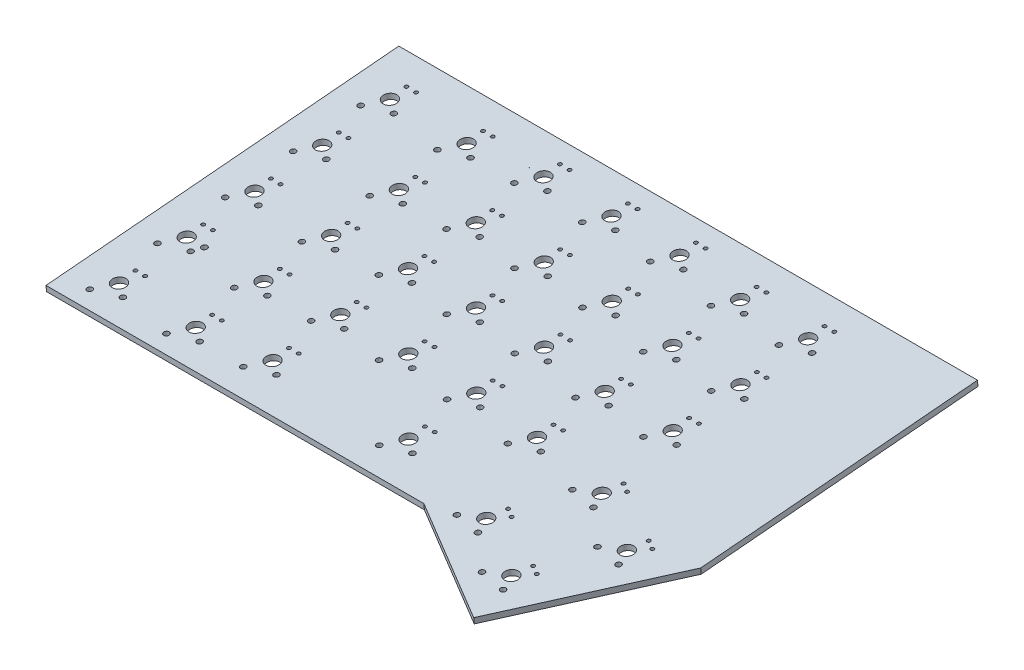
from build123d import *

# Parameters (mm, degrees)
STOCK_KEYBOARD_V0_5_1_START       = 8.153585203
STOCK_KEYBOARD_V0_5_1_OUTLINE_W   = 0.86
STOCK_KEYBOARD_V0_5_1_OUTLINE_H   = 0.199238939
STOCK_KEYBOARD_V0_5_1_OUTLINE_R   = 0.8
STOCK_KEYBOARD_V0_5_1_OUTLINE_R_2 = 1.917674794
STOCK_KEYBOARD_V0_5_1_OUTLINE_H_2 = 0.19923894
STOCK_KEYBOARD_V0_5_1_OUTLINE_R_3 = 0.800000002
STOCK_KEYBOARD_V0_5_1_DEPTH       = 1.6
BOSS_EXTRUDE1_DEPTH               = 2
SKETCH2_W                         = 12.211122084
SKETCH2_H                         = 11.225799909
BOSS_EXTRUDE2_DEPTH               = 1.6
SKETCH8_R                         = 0.800000002
SKETCH8_R_2                       = 1.917674794
SKETCH8_R_3                       = 0.8
SKETCH8_W                         = 0.86
SKETCH8_H                         = 0.199238939
SKETCH8_H_2                       = 0.19923894
CUT_EXTRUDE2_DEPTH                = 10
SKETCH9_W                         = 18.636404388
SKETCH9_H                         = 1.6
BOSS_EXTRUDE3_DEPTH               = 99.23940517
SKETCH10_R                        = 0.8
SKETCH10_R_2                      = 1.917674794
SKETCH10_R_3                      = 0.800000002
SKETCH10_W                        = 0.86
SKETCH10_H                        = 0.199238939
SKETCH10_H_2                      = 0.19923894
CUT_EXTRUDE3_DEPTH                = 10
SKETCH11_R                        = 0.76
SKETCH11_R_2                      = 0.5
CUT_EXTRUDE4_DEPTH                = 10
SKETCH12_R                        = 0.76
SKETCH12_R_2                      = 0.5
CUT_EXTRUDE5_DEPTH                = 10
SKETCH16_W                        = 2.577540071
SKETCH16_H                        = 2.149356262
SKETCH16_W_2                      = 3.120597437
SKETCH16_H_2                      = 2.428290264
SKETCH16_W_3                      = 2.641880847
SKETCH16_H_3                      = 2.522468401
SKETCH16_W_4                      = 2.716545772
SKETCH16_W_5                      = 2.843231933
SKETCH16_H_4                      = 2.954737192
SKETCH16_W_6                      = 2.376576368
SKETCH16_W_7                      = 2.885375069
SKETCH16_H_5                      = 3.436225536
SKETCH16_W_8                      = 3.501942623
SKETCH16_H_6                      = 2.951715006
SKETCH16_W_9                      = 2.599967252
SKETCH16_H_7                      = 2.710791034
SKETCH16_W_10                     = 3.515192919
SKETCH16_H_8                      = 2.596012122
SKETCH16_W_11                     = 2.781476093
SKETCH16_H_9                      = 2.55908052
SKETCH16_W_12                     = 3.197939424
SKETCH16_H_10                     = 3.007978315
SKETCH16_W_13                     = 2.678786583
SKETCH16_W_14                     = 2.811093027
SKETCH16_W_15                     = 4.270550498
SKETCH16_H_11                     = 2.846444103
SKETCH16_W_16                     = 3.376928095
SKETCH16_W_17                     = 2.939323769
SKETCH16_H_12                     = 2.37482897
SKETCH16_W_18                     = 3.720609395
SKETCH16_H_13                     = 3.075953947
SKETCH16_H_14                     = 1.901793453
SKETCH16_W_19                     = 2.800231831
SKETCH16_W_20                     = 2.894456656
SKETCH16_W_21                     = 2.657083424
SKETCH16_H_15                     = 3.198015133
SKETCH16_W_22                     = 2.547684604
SKETCH16_W_23                     = 2.807970224
SKETCH16_W_24                     = 3.536574832
SKETCH16_W_25                     = 3.562556698
SKETCH16_H_16                     = 2.860568444
SKETCH16_W_26                     = 2.698633559
SKETCH16_H_17                     = 2.567616595
SKETCH16_W_27                     = 2.566164199
SKETCH16_H_18                     = 2.646273972
SKETCH16_W_28                     = 3.838393819
SKETCH16_H_19                     = 2.632349807
SKETCH16_W_29                     = 3.484166296
SKETCH16_H_20                     = 4.022519716
SKETCH16_W_30                     = 4.301574493
SKETCH16_H_21                     = 4.551455811
SKETCH16_W_31                     = 3.854773681
SKETCH16_H_22                     = 2.585274645
SKETCH16_W_32                     = 3.504233353
SKETCH16_H_23                     = 3.281156811
SKETCH16_W_33                     = 4.396597945
SKETCH16_H_24                     = 3.684062471
SKETCH16_W_34                     = 3.385002429
SKETCH16_H_25                     = 2.982366182
SKETCH16_W_35                     = 3.053009833
SKETCH16_H_26                     = 3.89082527
SKETCH16_H_27                     = 3.393488872
SKETCH16_W_36                     = 3.579299083
SKETCH16_H_28                     = 3.402746668
SKETCH16_W_37                     = 2.565798926
SKETCH16_H_29                     = 2.399464786
SKETCH16_W_38                     = 3.452574156
SKETCH16_H_30                     = 3.105263637
SKETCH16_W_39                     = 2.703726549
SKETCH16_H_31                     = 2.396062937
SKETCH16_W_40                     = 2.662519685
SKETCH16_H_32                     = 2.54100766
SKETCH16_W_41                     = 2.818929949
SKETCH16_H_33                     = 2.608021171
SKETCH16_W_42                     = 3.439694331
SKETCH16_H_34                     = 2.7803539
SKETCH16_H_35                     = 3.050902385
SKETCH16_W_43                     = 3.483127389
SKETCH16_H_36                     = 3.644636808
SKETCH16_W_44                     = 2.949400195
SKETCH16_W_45                     = 4.347198904
SKETCH16_H_37                     = 4.590909571
SKETCH16_W_46                     = 3.314197669
SKETCH16_H_38                     = 3.235330186
SKETCH16_W_47                     = 3.315074248
SKETCH16_W_48                     = 3.681288839
SKETCH16_H_39                     = 2.971028945
SKETCH16_W_49                     = 2.512980308
SKETCH16_H_40                     = 2.301944439
SKETCH16_W_50                     = 2.591460255
SKETCH16_H_41                     = 2.581625053
SKETCH16_W_51                     = 2.545961971
SKETCH16_W_52                     = 3.98133778
SKETCH16_H_42                     = 2.262604843
SKETCH16_W_53                     = 4.037759366
SKETCH16_H_43                     = 3.212557147
SKETCH16_H_44                     = 3.327767197
SKETCH16_W_54                     = 2.425363174
SKETCH16_H_45                     = 2.276974464
SKETCH16_W_55                     = 2.73410915
SKETCH16_H_46                     = 3.009850778
SKETCH16_W_56                     = 3.349738561
SKETCH16_H_47                     = 2.654475435
SKETCH16_H_48                     = 2.754547453
SKETCH16_W_57                     = 3.22687062
SKETCH16_W_58                     = 2.833563032
SKETCH16_H_49                     = 2.353002664
BOSS_EXTRUDE4_DEPTH               = 1.6


# Read off the part's stored shape, not the designer's step: Stock-Keyboard_V0.5-1
with BuildPart() as part:
    # Stock-Keyboard_V0.5-1 outline → Stock-Keyboard_V0.5-1 (new body)
    with BuildSketch(Plane(origin=(0, 0, 0), x_dir=(1, 0, 0), z_dir=(0, 0.9961946980917461, 0.08715574274765152)).offset(STOCK_KEYBOARD_V0_5_1_START)):
        Polygon((-86.992451997, -16.120565328), (16.892226293, -16.120565328), (49.885492252, -35.226142918), (73.156699254, 5.268315368), (73.156699254, 83.118839842), (-86.992451997, 83.118839842), align=None)
        with Locations((-81.505730532, -11.331811429)):
            Rectangle(STOCK_KEYBOARD_V0_5_1_OUTLINE_W, STOCK_KEYBOARD_V0_5_1_OUTLINE_H, mode=Mode.SUBTRACT)
        with Locations((-83.425730532, -6.151598998)):
            Circle(STOCK_KEYBOARD_V0_5_1_OUTLINE_R, mode=Mode.SUBTRACT)
        with Locations((-78.475730532, -6.151598998)):
            Circle(STOCK_KEYBOARD_V0_5_1_OUTLINE_R_2, mode=Mode.SUBTRACT)
        with Locations((-74.705730532, -8.841324683)):
            Rectangle(STOCK_KEYBOARD_V0_5_1_OUTLINE_W, STOCK_KEYBOARD_V0_5_1_OUTLINE_H_2, mode=Mode.SUBTRACT)
        with Locations((-73.525730532, -6.151598998)):
            Circle(STOCK_KEYBOARD_V0_5_1_OUTLINE_R_3, mode=Mode.SUBTRACT)
        with Locations((-60.005730532, -11.331811429)):
            Rectangle(STOCK_KEYBOARD_V0_5_1_OUTLINE_W, STOCK_KEYBOARD_V0_5_1_OUTLINE_H, mode=Mode.SUBTRACT)
        with Locations((-61.925730532, -6.151598998)):
            Circle(STOCK_KEYBOARD_V0_5_1_OUTLINE_R, mode=Mode.SUBTRACT)
        with Locations((-56.975730532, -6.151598998)):
            Circle(STOCK_KEYBOARD_V0_5_1_OUTLINE_R_2, mode=Mode.SUBTRACT)
        with Locations((-53.205730532, -8.841324683)):
            Rectangle(STOCK_KEYBOARD_V0_5_1_OUTLINE_W, STOCK_KEYBOARD_V0_5_1_OUTLINE_H_2, mode=Mode.SUBTRACT)
        with Locations((-52.025730532, -6.151598998)):
            Circle(STOCK_KEYBOARD_V0_5_1_OUTLINE_R_3, mode=Mode.SUBTRACT)
        with Locations((-40.955730532, -8.831811429)):
            Rectangle(STOCK_KEYBOARD_V0_5_1_OUTLINE_W, STOCK_KEYBOARD_V0_5_1_OUTLINE_H, mode=Mode.SUBTRACT)
        with Locations((-34.155730532, -6.341324683)):
            Rectangle(STOCK_KEYBOARD_V0_5_1_OUTLINE_W, STOCK_KEYBOARD_V0_5_1_OUTLINE_H_2, mode=Mode.SUBTRACT)
        with Locations((-21.905730532, -6.781811429)):
            Rectangle(STOCK_KEYBOARD_V0_5_1_OUTLINE_W, STOCK_KEYBOARD_V0_5_1_OUTLINE_H, mode=Mode.SUBTRACT)
        with Locations((-81.505730532, 7.718188572)):
            Rectangle(STOCK_KEYBOARD_V0_5_1_OUTLINE_W, STOCK_KEYBOARD_V0_5_1_OUTLINE_H, mode=Mode.SUBTRACT)
        with Locations((-60.005730532, 7.718188572)):
            Rectangle(STOCK_KEYBOARD_V0_5_1_OUTLINE_W, STOCK_KEYBOARD_V0_5_1_OUTLINE_H, mode=Mode.SUBTRACT)
        with Locations((-83.425730532, 12.898401002)):
            Circle(STOCK_KEYBOARD_V0_5_1_OUTLINE_R, mode=Mode.SUBTRACT)
        with Locations((-78.475730532, 12.898401002)):
            Circle(STOCK_KEYBOARD_V0_5_1_OUTLINE_R_2, mode=Mode.SUBTRACT)
        with Locations((-74.705730532, 10.208675317)):
            Rectangle(STOCK_KEYBOARD_V0_5_1_OUTLINE_W, STOCK_KEYBOARD_V0_5_1_OUTLINE_H_2, mode=Mode.SUBTRACT)
        with Locations((-73.525730532, 12.898401002)):
            Circle(STOCK_KEYBOARD_V0_5_1_OUTLINE_R_3, mode=Mode.SUBTRACT)
        with Locations((-61.925730532, 12.898401002)):
            Circle(STOCK_KEYBOARD_V0_5_1_OUTLINE_R, mode=Mode.SUBTRACT)
        with Locations((-56.975730532, 12.898401002)):
            Circle(STOCK_KEYBOARD_V0_5_1_OUTLINE_R_2, mode=Mode.SUBTRACT)
        with Locations((-53.205730532, 10.208675317)):
            Rectangle(STOCK_KEYBOARD_V0_5_1_OUTLINE_W, STOCK_KEYBOARD_V0_5_1_OUTLINE_H_2, mode=Mode.SUBTRACT)
        with Locations((-52.025730532, 12.898401002)):
            Circle(STOCK_KEYBOARD_V0_5_1_OUTLINE_R_3, mode=Mode.SUBTRACT)
        with Locations((-42.875730532, -3.651598998)):
            Circle(STOCK_KEYBOARD_V0_5_1_OUTLINE_R, mode=Mode.SUBTRACT)
        with Locations((-37.925730532, -3.651598998)):
            Circle(STOCK_KEYBOARD_V0_5_1_OUTLINE_R_2, mode=Mode.SUBTRACT)
        with Locations((-32.975730532, -3.651598998)):
            Circle(STOCK_KEYBOARD_V0_5_1_OUTLINE_R_3, mode=Mode.SUBTRACT)
        with Locations((-23.825730532, -1.601598998)):
            Circle(STOCK_KEYBOARD_V0_5_1_OUTLINE_R, mode=Mode.SUBTRACT)
        with Locations((-18.875730532, -1.601598998)):
            Circle(STOCK_KEYBOARD_V0_5_1_OUTLINE_R_2, mode=Mode.SUBTRACT)
        with Locations((-15.105730532, -4.291324683)):
            Rectangle(STOCK_KEYBOARD_V0_5_1_OUTLINE_W, STOCK_KEYBOARD_V0_5_1_OUTLINE_H_2, mode=Mode.SUBTRACT)
        with Locations((-13.925730532, -1.601598998)):
            Circle(STOCK_KEYBOARD_V0_5_1_OUTLINE_R_3, mode=Mode.SUBTRACT)
        with Locations((-40.955730532, 10.218188572)):
            Rectangle(STOCK_KEYBOARD_V0_5_1_OUTLINE_W, STOCK_KEYBOARD_V0_5_1_OUTLINE_H, mode=Mode.SUBTRACT)
        with Locations((-42.875730532, 15.398401002)):
            Circle(STOCK_KEYBOARD_V0_5_1_OUTLINE_R, mode=Mode.SUBTRACT)
        with Locations((-37.925730532, 15.398401002)):
            Circle(STOCK_KEYBOARD_V0_5_1_OUTLINE_R_2, mode=Mode.SUBTRACT)
        with Locations((-34.155730532, 12.708675317)):
            Rectangle(STOCK_KEYBOARD_V0_5_1_OUTLINE_W, STOCK_KEYBOARD_V0_5_1_OUTLINE_H_2, mode=Mode.SUBTRACT)
        with Locations((-32.975730532, 15.398401002)):
            Circle(STOCK_KEYBOARD_V0_5_1_OUTLINE_R_3, mode=Mode.SUBTRACT)
        with Locations((-21.905730532, 12.268188572)):
            Rectangle(STOCK_KEYBOARD_V0_5_1_OUTLINE_W, STOCK_KEYBOARD_V0_5_1_OUTLINE_H, mode=Mode.SUBTRACT)
        with Locations((-15.105730532, 14.758675317)):
            Rectangle(STOCK_KEYBOARD_V0_5_1_OUTLINE_W, STOCK_KEYBOARD_V0_5_1_OUTLINE_H_2, mode=Mode.SUBTRACT)
        with Locations((-23.825730532, 17.448401002)):
            Circle(STOCK_KEYBOARD_V0_5_1_OUTLINE_R, mode=Mode.SUBTRACT)
        with Locations((-18.875730532, 17.448401002)):
            Circle(STOCK_KEYBOARD_V0_5_1_OUTLINE_R_2, mode=Mode.SUBTRACT)
        with Locations((-13.925730532, 17.448401002)):
            Circle(STOCK_KEYBOARD_V0_5_1_OUTLINE_R_3, mode=Mode.SUBTRACT)
        Polygon((2.039288601, -8.969892356), (1.208596308, -8.747293356), (1.260166528, -8.554844226), (2.090858821, -8.777443226), align=None, mode=Mode.SUBTRACT)
        Polygon((9.252056951, -8.324330109), (8.421364658, -8.10173111), (8.472934877, -7.90928198), (9.30362717, -8.13188098), align=None, mode=Mode.SUBTRACT)
        with Locations((10.692780005, -5.845444135)):
            Circle(STOCK_KEYBOARD_V0_5_1_OUTLINE_R, mode=Mode.SUBTRACT)
        Polygon((24.73235569, -14.681244045), (23.987419458, -14.251511557), (24.086976952, -14.078929807), (24.831913184, -14.508662295), align=None, mode=Mode.SUBTRACT)
        Polygon((31.866814495, -15.92173966), (31.121878263, -15.492007172), (31.221435757, -15.319425422), (31.966371989, -15.74915791), align=None, mode=Mode.SUBTRACT)
        with Locations((29.639757553, -11.377557468)):
            Circle(STOCK_KEYBOARD_V0_5_1_OUTLINE_R_2, mode=Mode.SUBTRACT)
        with Locations((25.352043197, -8.904097219)):
            Circle(STOCK_KEYBOARD_V0_5_1_OUTLINE_R, mode=Mode.SUBTRACT)
        Polygon((41.283210061, -24.228960371), (40.538273829, -23.799227883), (40.637831324, -23.626646133), (41.382767555, -24.056378621), align=None, mode=Mode.SUBTRACT)
        Polygon((48.417668866, -25.469455986), (47.672732635, -25.039723498), (47.772290129, -24.867141748), (48.51722636, -25.296874236), align=None, mode=Mode.SUBTRACT)
        with Locations((46.190611924, -20.925273794)):
            Circle(STOCK_KEYBOARD_V0_5_1_OUTLINE_R_2, mode=Mode.SUBTRACT)
        with Locations((50.502211251, -23.356859953)):
            Circle(STOCK_KEYBOARD_V0_5_1_OUTLINE_R, mode=Mode.SUBTRACT)
        with Locations((41.902897568, -18.451813546)):
            Circle(STOCK_KEYBOARD_V0_5_1_OUTLINE_R, mode=Mode.SUBTRACT)
        with Locations((33.951356879, -13.809143627)):
            Circle(STOCK_KEYBOARD_V0_5_1_OUTLINE_R, mode=Mode.SUBTRACT)
        with Locations((1.139512111, -3.248561141)):
            Circle(STOCK_KEYBOARD_V0_5_1_OUTLINE_R, mode=Mode.SUBTRACT)
        with Locations((5.920822401, -4.529799569)):
            Circle(STOCK_KEYBOARD_V0_5_1_OUTLINE_R_2, mode=Mode.SUBTRACT)
        with Locations((16.194269468, 8.168188571)):
            Rectangle(STOCK_KEYBOARD_V0_5_1_OUTLINE_W, STOCK_KEYBOARD_V0_5_1_OUTLINE_H, mode=Mode.SUBTRACT)
        with Locations((-2.855730532, 10.218188572)):
            Rectangle(STOCK_KEYBOARD_V0_5_1_OUTLINE_W, STOCK_KEYBOARD_V0_5_1_OUTLINE_H, mode=Mode.SUBTRACT)
        with Locations((-4.775730532, 15.398401002)):
            Circle(STOCK_KEYBOARD_V0_5_1_OUTLINE_R, mode=Mode.SUBTRACT)
        with Locations((0.174269468, 15.398401002)):
            Circle(STOCK_KEYBOARD_V0_5_1_OUTLINE_R_2, mode=Mode.SUBTRACT)
        with Locations((3.944269468, 12.708675317)):
            Rectangle(STOCK_KEYBOARD_V0_5_1_OUTLINE_W, STOCK_KEYBOARD_V0_5_1_OUTLINE_H_2, mode=Mode.SUBTRACT)
        with Locations((5.124269468, 15.398401002)):
            Circle(STOCK_KEYBOARD_V0_5_1_OUTLINE_R_3, mode=Mode.SUBTRACT)
        with Locations((22.994269468, 10.658675317)):
            Rectangle(STOCK_KEYBOARD_V0_5_1_OUTLINE_W, STOCK_KEYBOARD_V0_5_1_OUTLINE_H_2, mode=Mode.SUBTRACT)
        with Locations((14.274269468, 13.348401002)):
            Circle(STOCK_KEYBOARD_V0_5_1_OUTLINE_R, mode=Mode.SUBTRACT)
        with Locations((19.224269468, 13.348401002)):
            Circle(STOCK_KEYBOARD_V0_5_1_OUTLINE_R_2, mode=Mode.SUBTRACT)
        with Locations((24.174269468, 13.348401002)):
            Circle(STOCK_KEYBOARD_V0_5_1_OUTLINE_R_3, mode=Mode.SUBTRACT)
        Polygon((53.149712453, -3.658517526), (52.404776222, -3.228785038), (52.504333716, -3.056203288), (53.249269947, -3.485935776), align=None, mode=Mode.SUBTRACT)
        Polygon((36.598858082, 5.8891988), (35.85392185, 6.318931288), (35.953479344, 6.491513038), (36.698415576, 6.06178055), align=None, mode=Mode.SUBTRACT)
        Polygon((43.733316887, 4.648703185), (42.988380655, 5.078435673), (43.08793815, 5.251017423), (43.832874381, 4.821284935), align=None, mode=Mode.SUBTRACT)
        with Locations((45.817859271, 6.761299218)):
            Circle(STOCK_KEYBOARD_V0_5_1_OUTLINE_R, mode=Mode.SUBTRACT)
        Polygon((60.284171258, -4.899013141), (59.539235027, -4.469280653), (59.638792521, -4.296698903), (60.383728753, -4.726431391), align=None, mode=Mode.SUBTRACT)
        with Locations((62.368713643, -2.786417108)):
            Circle(STOCK_KEYBOARD_V0_5_1_OUTLINE_R, mode=Mode.SUBTRACT)
        with Locations((58.057114316, -0.354830949)):
            Circle(STOCK_KEYBOARD_V0_5_1_OUTLINE_R_2, mode=Mode.SUBTRACT)
        with Locations((53.76939996, 2.118629299)):
            Circle(STOCK_KEYBOARD_V0_5_1_OUTLINE_R, mode=Mode.SUBTRACT)
        with Locations((37.218545589, 11.666345626)):
            Circle(STOCK_KEYBOARD_V0_5_1_OUTLINE_R, mode=Mode.SUBTRACT)
        with Locations((41.506259945, 9.192885377)):
            Circle(STOCK_KEYBOARD_V0_5_1_OUTLINE_R_2, mode=Mode.SUBTRACT)
        with Locations((-81.505730532, 26.768188572)):
            Rectangle(STOCK_KEYBOARD_V0_5_1_OUTLINE_W, STOCK_KEYBOARD_V0_5_1_OUTLINE_H, mode=Mode.SUBTRACT)
        with Locations((-74.705730532, 29.258675317)):
            Rectangle(STOCK_KEYBOARD_V0_5_1_OUTLINE_W, STOCK_KEYBOARD_V0_5_1_OUTLINE_H_2, mode=Mode.SUBTRACT)
        with Locations((-83.425730532, 31.948401002)):
            Circle(STOCK_KEYBOARD_V0_5_1_OUTLINE_R, mode=Mode.SUBTRACT)
        with Locations((-78.475730532, 31.948401002)):
            Circle(STOCK_KEYBOARD_V0_5_1_OUTLINE_R_2, mode=Mode.SUBTRACT)
        with Locations((-73.525730532, 31.948401002)):
            Circle(STOCK_KEYBOARD_V0_5_1_OUTLINE_R_3, mode=Mode.SUBTRACT)
        with Locations((-60.005730532, 26.768188572)):
            Rectangle(STOCK_KEYBOARD_V0_5_1_OUTLINE_W, STOCK_KEYBOARD_V0_5_1_OUTLINE_H, mode=Mode.SUBTRACT)
        with Locations((-53.205730532, 29.258675317)):
            Rectangle(STOCK_KEYBOARD_V0_5_1_OUTLINE_W, STOCK_KEYBOARD_V0_5_1_OUTLINE_H_2, mode=Mode.SUBTRACT)
        with Locations((-61.925730532, 31.948401002)):
            Circle(STOCK_KEYBOARD_V0_5_1_OUTLINE_R, mode=Mode.SUBTRACT)
        with Locations((-56.975730532, 31.948401002)):
            Circle(STOCK_KEYBOARD_V0_5_1_OUTLINE_R_2, mode=Mode.SUBTRACT)
        with Locations((-52.025730532, 31.948401002)):
            Circle(STOCK_KEYBOARD_V0_5_1_OUTLINE_R_3, mode=Mode.SUBTRACT)
        with Locations((-81.505730532, 45.818188572)):
            Rectangle(STOCK_KEYBOARD_V0_5_1_OUTLINE_W, STOCK_KEYBOARD_V0_5_1_OUTLINE_H, mode=Mode.SUBTRACT)
        with Locations((-83.425730532, 50.998401002)):
            Circle(STOCK_KEYBOARD_V0_5_1_OUTLINE_R, mode=Mode.SUBTRACT)
        with Locations((-78.475730532, 50.998401002)):
            Circle(STOCK_KEYBOARD_V0_5_1_OUTLINE_R_2, mode=Mode.SUBTRACT)
        with Locations((-74.705730532, 48.308675317)):
            Rectangle(STOCK_KEYBOARD_V0_5_1_OUTLINE_W, STOCK_KEYBOARD_V0_5_1_OUTLINE_H_2, mode=Mode.SUBTRACT)
        with Locations((-73.525730532, 50.998401002)):
            Circle(STOCK_KEYBOARD_V0_5_1_OUTLINE_R_3, mode=Mode.SUBTRACT)
        with Locations((-60.005730532, 45.818188572)):
            Rectangle(STOCK_KEYBOARD_V0_5_1_OUTLINE_W, STOCK_KEYBOARD_V0_5_1_OUTLINE_H, mode=Mode.SUBTRACT)
        with Locations((-61.925730532, 50.998401002)):
            Circle(STOCK_KEYBOARD_V0_5_1_OUTLINE_R, mode=Mode.SUBTRACT)
        with Locations((-56.975730532, 50.998401002)):
            Circle(STOCK_KEYBOARD_V0_5_1_OUTLINE_R_2, mode=Mode.SUBTRACT)
        with Locations((-53.205730532, 48.308675317)):
            Rectangle(STOCK_KEYBOARD_V0_5_1_OUTLINE_W, STOCK_KEYBOARD_V0_5_1_OUTLINE_H_2, mode=Mode.SUBTRACT)
        with Locations((-52.025730532, 50.998401002)):
            Circle(STOCK_KEYBOARD_V0_5_1_OUTLINE_R_3, mode=Mode.SUBTRACT)
        with Locations((-40.955730532, 29.268188572)):
            Rectangle(STOCK_KEYBOARD_V0_5_1_OUTLINE_W, STOCK_KEYBOARD_V0_5_1_OUTLINE_H, mode=Mode.SUBTRACT)
        with Locations((-42.875730532, 34.448401002)):
            Circle(STOCK_KEYBOARD_V0_5_1_OUTLINE_R, mode=Mode.SUBTRACT)
        with Locations((-37.925730532, 34.448401002)):
            Circle(STOCK_KEYBOARD_V0_5_1_OUTLINE_R_2, mode=Mode.SUBTRACT)
        with Locations((-34.155730532, 31.758675317)):
            Rectangle(STOCK_KEYBOARD_V0_5_1_OUTLINE_W, STOCK_KEYBOARD_V0_5_1_OUTLINE_H_2, mode=Mode.SUBTRACT)
        with Locations((-32.975730532, 34.448401002)):
            Circle(STOCK_KEYBOARD_V0_5_1_OUTLINE_R_3, mode=Mode.SUBTRACT)
        with Locations((-21.905730532, 31.318188572)):
            Rectangle(STOCK_KEYBOARD_V0_5_1_OUTLINE_W, STOCK_KEYBOARD_V0_5_1_OUTLINE_H, mode=Mode.SUBTRACT)
        with Locations((-23.825730532, 36.498401002)):
            Circle(STOCK_KEYBOARD_V0_5_1_OUTLINE_R, mode=Mode.SUBTRACT)
        with Locations((-18.875730532, 36.498401002)):
            Circle(STOCK_KEYBOARD_V0_5_1_OUTLINE_R_2, mode=Mode.SUBTRACT)
        with Locations((-15.105730532, 33.808675317)):
            Rectangle(STOCK_KEYBOARD_V0_5_1_OUTLINE_W, STOCK_KEYBOARD_V0_5_1_OUTLINE_H_2, mode=Mode.SUBTRACT)
        with Locations((-13.925730532, 36.498401002)):
            Circle(STOCK_KEYBOARD_V0_5_1_OUTLINE_R_3, mode=Mode.SUBTRACT)
        with Locations((-40.955730532, 48.318188572)):
            Rectangle(STOCK_KEYBOARD_V0_5_1_OUTLINE_W, STOCK_KEYBOARD_V0_5_1_OUTLINE_H, mode=Mode.SUBTRACT)
        with Locations((-42.875730532, 53.498401002)):
            Circle(STOCK_KEYBOARD_V0_5_1_OUTLINE_R, mode=Mode.SUBTRACT)
        with Locations((-37.925730532, 53.498401002)):
            Circle(STOCK_KEYBOARD_V0_5_1_OUTLINE_R_2, mode=Mode.SUBTRACT)
        with Locations((-34.155730532, 50.808675317)):
            Rectangle(STOCK_KEYBOARD_V0_5_1_OUTLINE_W, STOCK_KEYBOARD_V0_5_1_OUTLINE_H_2, mode=Mode.SUBTRACT)
        with Locations((-32.975730532, 53.498401002)):
            Circle(STOCK_KEYBOARD_V0_5_1_OUTLINE_R_3, mode=Mode.SUBTRACT)
        with Locations((-21.905730532, 50.368188571)):
            Rectangle(STOCK_KEYBOARD_V0_5_1_OUTLINE_W, STOCK_KEYBOARD_V0_5_1_OUTLINE_H, mode=Mode.SUBTRACT)
        with Locations((-15.105730532, 52.858675317)):
            Rectangle(STOCK_KEYBOARD_V0_5_1_OUTLINE_W, STOCK_KEYBOARD_V0_5_1_OUTLINE_H_2, mode=Mode.SUBTRACT)
        with Locations((-81.505730532, 64.868188571)):
            Rectangle(STOCK_KEYBOARD_V0_5_1_OUTLINE_W, STOCK_KEYBOARD_V0_5_1_OUTLINE_H, mode=Mode.SUBTRACT)
        with Locations((-74.705730532, 67.358675317)):
            Rectangle(STOCK_KEYBOARD_V0_5_1_OUTLINE_W, STOCK_KEYBOARD_V0_5_1_OUTLINE_H_2, mode=Mode.SUBTRACT)
        with Locations((-60.005730532, 64.868188571)):
            Rectangle(STOCK_KEYBOARD_V0_5_1_OUTLINE_W, STOCK_KEYBOARD_V0_5_1_OUTLINE_H, mode=Mode.SUBTRACT)
        with Locations((-53.205730532, 67.358675317)):
            Rectangle(STOCK_KEYBOARD_V0_5_1_OUTLINE_W, STOCK_KEYBOARD_V0_5_1_OUTLINE_H_2, mode=Mode.SUBTRACT)
        with Locations((-83.425730532, 70.048401002)):
            Circle(STOCK_KEYBOARD_V0_5_1_OUTLINE_R, mode=Mode.SUBTRACT)
        with Locations((-78.475730532, 70.048401002)):
            Circle(STOCK_KEYBOARD_V0_5_1_OUTLINE_R_2, mode=Mode.SUBTRACT)
        with Locations((-73.525730532, 70.048401002)):
            Circle(STOCK_KEYBOARD_V0_5_1_OUTLINE_R_3, mode=Mode.SUBTRACT)
        with Locations((-61.925730532, 70.048401002)):
            Circle(STOCK_KEYBOARD_V0_5_1_OUTLINE_R, mode=Mode.SUBTRACT)
        with Locations((-56.975730532, 70.048401002)):
            Circle(STOCK_KEYBOARD_V0_5_1_OUTLINE_R_2, mode=Mode.SUBTRACT)
        with Locations((-52.025730532, 70.048401002)):
            Circle(STOCK_KEYBOARD_V0_5_1_OUTLINE_R_3, mode=Mode.SUBTRACT)
        with Locations((-40.955730532, 67.368188571)):
            Rectangle(STOCK_KEYBOARD_V0_5_1_OUTLINE_W, STOCK_KEYBOARD_V0_5_1_OUTLINE_H, mode=Mode.SUBTRACT)
        with Locations((-23.825730532, 55.548401002)):
            Circle(STOCK_KEYBOARD_V0_5_1_OUTLINE_R, mode=Mode.SUBTRACT)
        with Locations((-18.875730532, 55.548401002)):
            Circle(STOCK_KEYBOARD_V0_5_1_OUTLINE_R_2, mode=Mode.SUBTRACT)
        with Locations((-13.925730532, 55.548401002)):
            Circle(STOCK_KEYBOARD_V0_5_1_OUTLINE_R_3, mode=Mode.SUBTRACT)
        with Locations((-42.875730532, 72.548401002)):
            Circle(STOCK_KEYBOARD_V0_5_1_OUTLINE_R, mode=Mode.SUBTRACT)
        with Locations((-37.925730532, 72.548401002)):
            Circle(STOCK_KEYBOARD_V0_5_1_OUTLINE_R_2, mode=Mode.SUBTRACT)
        with Locations((-34.155730532, 69.858675317)):
            Rectangle(STOCK_KEYBOARD_V0_5_1_OUTLINE_W, STOCK_KEYBOARD_V0_5_1_OUTLINE_H_2, mode=Mode.SUBTRACT)
        with Locations((-32.975730532, 72.548401002)):
            Circle(STOCK_KEYBOARD_V0_5_1_OUTLINE_R_3, mode=Mode.SUBTRACT)
        with Locations((-21.905730532, 69.418188571)):
            Rectangle(STOCK_KEYBOARD_V0_5_1_OUTLINE_W, STOCK_KEYBOARD_V0_5_1_OUTLINE_H, mode=Mode.SUBTRACT)
        with Locations((-23.825730532, 74.598401002)):
            Circle(STOCK_KEYBOARD_V0_5_1_OUTLINE_R, mode=Mode.SUBTRACT)
        with Locations((-18.875730532, 74.598401002)):
            Circle(STOCK_KEYBOARD_V0_5_1_OUTLINE_R_2, mode=Mode.SUBTRACT)
        with Locations((-15.105730532, 71.908675317)):
            Rectangle(STOCK_KEYBOARD_V0_5_1_OUTLINE_W, STOCK_KEYBOARD_V0_5_1_OUTLINE_H_2, mode=Mode.SUBTRACT)
        with Locations((-13.925730532, 74.598401002)):
            Circle(STOCK_KEYBOARD_V0_5_1_OUTLINE_R_3, mode=Mode.SUBTRACT)
        with Locations((-2.855730532, 29.268188572)):
            Rectangle(STOCK_KEYBOARD_V0_5_1_OUTLINE_W, STOCK_KEYBOARD_V0_5_1_OUTLINE_H, mode=Mode.SUBTRACT)
        with Locations((-4.775730532, 34.448401002)):
            Circle(STOCK_KEYBOARD_V0_5_1_OUTLINE_R, mode=Mode.SUBTRACT)
        with Locations((0.174269468, 34.448401002)):
            Circle(STOCK_KEYBOARD_V0_5_1_OUTLINE_R_2, mode=Mode.SUBTRACT)
        with Locations((3.944269468, 31.758675317)):
            Rectangle(STOCK_KEYBOARD_V0_5_1_OUTLINE_W, STOCK_KEYBOARD_V0_5_1_OUTLINE_H_2, mode=Mode.SUBTRACT)
        with Locations((5.124269468, 34.448401002)):
            Circle(STOCK_KEYBOARD_V0_5_1_OUTLINE_R_3, mode=Mode.SUBTRACT)
        with Locations((16.194269468, 27.218188572)):
            Rectangle(STOCK_KEYBOARD_V0_5_1_OUTLINE_W, STOCK_KEYBOARD_V0_5_1_OUTLINE_H, mode=Mode.SUBTRACT)
        with Locations((22.994269468, 29.708675317)):
            Rectangle(STOCK_KEYBOARD_V0_5_1_OUTLINE_W, STOCK_KEYBOARD_V0_5_1_OUTLINE_H_2, mode=Mode.SUBTRACT)
        with Locations((14.274269468, 32.398401002)):
            Circle(STOCK_KEYBOARD_V0_5_1_OUTLINE_R, mode=Mode.SUBTRACT)
        with Locations((19.224269468, 32.398401002)):
            Circle(STOCK_KEYBOARD_V0_5_1_OUTLINE_R_2, mode=Mode.SUBTRACT)
        with Locations((24.174269468, 32.398401002)):
            Circle(STOCK_KEYBOARD_V0_5_1_OUTLINE_R_3, mode=Mode.SUBTRACT)
        with Locations((-2.855730532, 48.318188572)):
            Rectangle(STOCK_KEYBOARD_V0_5_1_OUTLINE_W, STOCK_KEYBOARD_V0_5_1_OUTLINE_H, mode=Mode.SUBTRACT)
        with Locations((-4.775730532, 53.498401002)):
            Circle(STOCK_KEYBOARD_V0_5_1_OUTLINE_R, mode=Mode.SUBTRACT)
        with Locations((0.174269468, 53.498401002)):
            Circle(STOCK_KEYBOARD_V0_5_1_OUTLINE_R_2, mode=Mode.SUBTRACT)
        with Locations((3.944269468, 50.808675317)):
            Rectangle(STOCK_KEYBOARD_V0_5_1_OUTLINE_W, STOCK_KEYBOARD_V0_5_1_OUTLINE_H_2, mode=Mode.SUBTRACT)
        with Locations((5.124269468, 53.498401002)):
            Circle(STOCK_KEYBOARD_V0_5_1_OUTLINE_R_3, mode=Mode.SUBTRACT)
        with Locations((16.194269468, 46.268188572)):
            Rectangle(STOCK_KEYBOARD_V0_5_1_OUTLINE_W, STOCK_KEYBOARD_V0_5_1_OUTLINE_H, mode=Mode.SUBTRACT)
        with Locations((22.994269468, 48.758675317)):
            Rectangle(STOCK_KEYBOARD_V0_5_1_OUTLINE_W, STOCK_KEYBOARD_V0_5_1_OUTLINE_H_2, mode=Mode.SUBTRACT)
        with Locations((14.274269468, 51.448401002)):
            Circle(STOCK_KEYBOARD_V0_5_1_OUTLINE_R, mode=Mode.SUBTRACT)
        with Locations((19.224269468, 51.448401002)):
            Circle(STOCK_KEYBOARD_V0_5_1_OUTLINE_R_2, mode=Mode.SUBTRACT)
        with Locations((24.174269468, 51.448401002)):
            Circle(STOCK_KEYBOARD_V0_5_1_OUTLINE_R_3, mode=Mode.SUBTRACT)
        with Locations((35.244269468, 27.218188572)):
            Rectangle(STOCK_KEYBOARD_V0_5_1_OUTLINE_W, STOCK_KEYBOARD_V0_5_1_OUTLINE_H, mode=Mode.SUBTRACT)
        with Locations((42.044269468, 29.708675317)):
            Rectangle(STOCK_KEYBOARD_V0_5_1_OUTLINE_W, STOCK_KEYBOARD_V0_5_1_OUTLINE_H_2, mode=Mode.SUBTRACT)
        with Locations((33.324269468, 32.398401002)):
            Circle(STOCK_KEYBOARD_V0_5_1_OUTLINE_R, mode=Mode.SUBTRACT)
        with Locations((38.274269468, 32.398401002)):
            Circle(STOCK_KEYBOARD_V0_5_1_OUTLINE_R_2, mode=Mode.SUBTRACT)
        with Locations((43.224269468, 32.398401002)):
            Circle(STOCK_KEYBOARD_V0_5_1_OUTLINE_R_3, mode=Mode.SUBTRACT)
        with Locations((35.244269468, 46.268188572)):
            Rectangle(STOCK_KEYBOARD_V0_5_1_OUTLINE_W, STOCK_KEYBOARD_V0_5_1_OUTLINE_H, mode=Mode.SUBTRACT)
        with Locations((42.044269468, 48.758675317)):
            Rectangle(STOCK_KEYBOARD_V0_5_1_OUTLINE_W, STOCK_KEYBOARD_V0_5_1_OUTLINE_H_2, mode=Mode.SUBTRACT)
        with Locations((33.324269468, 51.448401002)):
            Circle(STOCK_KEYBOARD_V0_5_1_OUTLINE_R, mode=Mode.SUBTRACT)
        with Locations((38.274269468, 51.448401002)):
            Circle(STOCK_KEYBOARD_V0_5_1_OUTLINE_R_2, mode=Mode.SUBTRACT)
        with Locations((43.224269468, 51.448401002)):
            Circle(STOCK_KEYBOARD_V0_5_1_OUTLINE_R_3, mode=Mode.SUBTRACT)
        with Locations((-2.855730532, 67.368188571)):
            Rectangle(STOCK_KEYBOARD_V0_5_1_OUTLINE_W, STOCK_KEYBOARD_V0_5_1_OUTLINE_H, mode=Mode.SUBTRACT)
        with Locations((16.194269468, 65.318188572)):
            Rectangle(STOCK_KEYBOARD_V0_5_1_OUTLINE_W, STOCK_KEYBOARD_V0_5_1_OUTLINE_H, mode=Mode.SUBTRACT)
        with Locations((22.994269468, 67.808675317)):
            Rectangle(STOCK_KEYBOARD_V0_5_1_OUTLINE_W, STOCK_KEYBOARD_V0_5_1_OUTLINE_H_2, mode=Mode.SUBTRACT)
        with Locations((-4.775730532, 72.548401002)):
            Circle(STOCK_KEYBOARD_V0_5_1_OUTLINE_R, mode=Mode.SUBTRACT)
        with Locations((0.174269468, 72.548401002)):
            Circle(STOCK_KEYBOARD_V0_5_1_OUTLINE_R_2, mode=Mode.SUBTRACT)
        with Locations((3.944269468, 69.858675317)):
            Rectangle(STOCK_KEYBOARD_V0_5_1_OUTLINE_W, STOCK_KEYBOARD_V0_5_1_OUTLINE_H_2, mode=Mode.SUBTRACT)
        with Locations((5.124269468, 72.548401002)):
            Circle(STOCK_KEYBOARD_V0_5_1_OUTLINE_R_3, mode=Mode.SUBTRACT)
        with Locations((14.274269468, 70.498401002)):
            Circle(STOCK_KEYBOARD_V0_5_1_OUTLINE_R, mode=Mode.SUBTRACT)
        with Locations((19.224269468, 70.498401002)):
            Circle(STOCK_KEYBOARD_V0_5_1_OUTLINE_R_2, mode=Mode.SUBTRACT)
        with Locations((24.174269468, 70.498401002)):
            Circle(STOCK_KEYBOARD_V0_5_1_OUTLINE_R_3, mode=Mode.SUBTRACT)
        with Locations((35.244269468, 65.318188572)):
            Rectangle(STOCK_KEYBOARD_V0_5_1_OUTLINE_W, STOCK_KEYBOARD_V0_5_1_OUTLINE_H, mode=Mode.SUBTRACT)
        with Locations((42.044269468, 67.808675317)):
            Rectangle(STOCK_KEYBOARD_V0_5_1_OUTLINE_W, STOCK_KEYBOARD_V0_5_1_OUTLINE_H_2, mode=Mode.SUBTRACT)
        with Locations((33.324269468, 70.498401002)):
            Circle(STOCK_KEYBOARD_V0_5_1_OUTLINE_R, mode=Mode.SUBTRACT)
        with Locations((38.274269468, 70.498401002)):
            Circle(STOCK_KEYBOARD_V0_5_1_OUTLINE_R_2, mode=Mode.SUBTRACT)
        with Locations((43.224269468, 70.498401002)):
            Circle(STOCK_KEYBOARD_V0_5_1_OUTLINE_R_3, mode=Mode.SUBTRACT)
    extrude(amount=STOCK_KEYBOARD_V0_5_1_DEPTH)

    # Sketch1 → Boss-Extrude1 (add)
    with BuildSketch(Plane.ZY.offset(86.992451997)):
        Polygon((16.909302673, 8.311470022), (-81.9524666, 16.96075409), (-82.091915788, 15.366842573), (16.769853484, 6.717558505), align=None)
    extrude(amount=BOSS_EXTRUDE1_DEPTH)

    # Sketch2 → Boss-Extrude2 (add)
    with BuildSketch(Plane(origin=(0, 9.716469867, 0.850080963), x_dir=(1, 0, 0), z_dir=(0, 0.9961946980917462, 0.08715574274765157))):
        with Locations((6.105561042, -4.516421695)):
            Rectangle(SKETCH2_W, SKETCH2_H)
    extrude(amount=-BOSS_EXTRUDE2_DEPTH)

    # Sketch8 → Cut-Extrude2 (cut)
    with BuildSketch(Plane(origin=(0, 9.716469867, 0.850080963), x_dir=(1, 0, 0), z_dir=(0, 0.9961946980917462, 0.08715574274765157))):
        with Locations(Location((5.124269468, -3.651598998, 0), (0, 0, 270))):
            Circle(SKETCH8_R)
        with Locations(Location((0.174269468, -3.651598998, 0), (0, 0, 270))):
            Circle(SKETCH8_R_2)
        with Locations(Location((-4.775730532, -3.651598998, 0), (0, 0, 270))):
            Circle(SKETCH8_R_3)
        with Locations((-2.855730532, -8.831811429)):
            Rectangle(SKETCH8_W, SKETCH8_H)
        with Locations((3.944269468, -6.341324683)):
            Rectangle(SKETCH8_W, SKETCH8_H_2)
    extrude(amount=-CUT_EXTRUDE2_DEPTH, mode=Mode.SUBTRACT)

    # Sketch9 → Boss-Extrude3 (add)
    with BuildSketch(Plane(origin=(0, 7.244284223, -82.802547563), x_dir=(-1, 0, 0), z_dir=(0, 0.08715574274765157, -0.9961946980917462))):
        with Locations((17.830528162, 8.953585203)):
            Rectangle(SKETCH9_W, SKETCH9_H)
    extrude(amount=-BOSS_EXTRUDE3_DEPTH)

    # Sketch10 → Cut-Extrude3 (cut)
    with BuildSketch(Plane(origin=(0, 9.716469867, 0.850080963), x_dir=(1, 0, 0), z_dir=(0, 0.9961946980917462, 0.08715574274765157))):
        with Locations(Location((-23.825730531, 53.498401002, 0), (0, 0, 270))):
            Circle(SKETCH10_R)
        with Locations(Location((-18.875730531, 53.498401002, 0), (0, 0, 270))):
            Circle(SKETCH10_R_2)
        with Locations(Location((-13.925730531, 53.498401002, 0), (0, 0, 270))):
            Circle(SKETCH10_R_3)
        with Locations(Location((-13.925730531, 72.548401002, 0), (0, 0, 270))):
            Circle(SKETCH10_R_3)
        with Locations(Location((-23.825730531, 72.548401002, 0), (0, 0, 270))):
            Circle(SKETCH10_R)
        with Locations(Location((-18.875730531, 72.548401002, 0), (0, 0, 270))):
            Circle(SKETCH10_R_2)
        with Locations(Location((-23.825730531, 34.448401002, 0), (0, 0, 270))):
            Circle(SKETCH10_R)
        with Locations(Location((-18.875730531, 34.448401002, 0), (0, 0, 270))):
            Circle(SKETCH10_R_2)
        with Locations(Location((-13.925730531, 34.448401002, 0), (0, 0, 270))):
            Circle(SKETCH10_R_3)
        with Locations(Location((-23.825730531, 15.398401002, 0), (0, 0, 270))):
            Circle(SKETCH10_R)
        with Locations(Location((-18.875730531, 15.398401002, 0), (0, 0, 270))):
            Circle(SKETCH10_R_2)
        with Locations(Location((-13.925730531, 15.398401002, 0), (0, 0, 270))):
            Circle(SKETCH10_R_3)
        with Locations((-21.905730531, 48.318188572)):
            Rectangle(SKETCH10_W, SKETCH10_H)
        with Locations((-15.105730531, 50.808675317)):
            Rectangle(SKETCH10_W, SKETCH10_H_2)
        with Locations((-21.905730531, 67.368188571)):
            Rectangle(SKETCH10_W, SKETCH10_H)
        with Locations((-15.105730531, 69.858675317)):
            Rectangle(SKETCH10_W, SKETCH10_H_2)
        with Locations((-21.905730531, 29.268188572)):
            Rectangle(SKETCH10_W, SKETCH10_H)
        with Locations((-15.105730531, 31.758675317)):
            Rectangle(SKETCH10_W, SKETCH10_H_2)
        with Locations((-21.905730531, 10.218188572)):
            Rectangle(SKETCH10_W, SKETCH10_H)
        with Locations((-15.105730531, 12.708675317)):
            Rectangle(SKETCH10_W, SKETCH10_H_2)
    extrude(amount=-CUT_EXTRUDE3_DEPTH, mode=Mode.SUBTRACT)

    # Sketch11 → Cut-Extrude4 (cut)
    with BuildSketch(Plane(origin=(0, 9.716469867, 0.850080963), x_dir=(1, 0, 0), z_dir=(0, 0.9961946980917462, 0.08715574274765157))):
        with Locations(Location((-81.505730532, 64.868188572, 0), (0, 0, 270))):
            Circle(SKETCH11_R)
        with Locations(Location((-74.705730532, 67.358675317, 0), (0, 0, 270))):
            Circle(SKETCH11_R)
        with Locations(Location((-76.065730532, 74.978675317, 0), (0, 0, 270))):
            Circle(SKETCH11_R_2)
        with Locations(Location((-78.785730532, 74.978675317, 0), (0, 0, 270))):
            Circle(SKETCH11_R_2)
        with Locations(Location((-53.205730532, 67.358675317, 0), (0, 0, 270))):
            Circle(SKETCH11_R)
        with Locations(Location((-54.565730532, 74.978675317, 0), (0, 0, 270))):
            Circle(SKETCH11_R_2)
        with Locations(Location((-60.005730532, 64.868188572, 0), (0, 0, 270))):
            Circle(SKETCH11_R)
        with Locations(Location((-57.285730532, 74.978675317, 0), (0, 0, 270))):
            Circle(SKETCH11_R_2)
        with Locations(Location((-34.155730532, 69.858675317, 0), (0, 0, 270))):
            Circle(SKETCH11_R)
        with Locations(Location((-35.515730532, 77.478675317, 0), (0, 0, 270))):
            Circle(SKETCH11_R_2)
        with Locations(Location((-40.955730532, 67.368188572, 0), (0, 0, 270))):
            Circle(SKETCH11_R)
        with Locations(Location((-38.235730532, 77.478675317, 0), (0, 0, 270))):
            Circle(SKETCH11_R_2)
        with Locations(Location((-15.105730531, 69.858675317, 0), (0, 0, 270))):
            Circle(SKETCH11_R)
        with Locations(Location((-16.465730531, 77.478675317, 0), (0, 0, 270))):
            Circle(SKETCH11_R_2)
        with Locations(Location((-21.905730531, 67.368188572, 0), (0, 0, 270))):
            Circle(SKETCH11_R)
        with Locations(Location((-19.185730531, 77.478675317, 0), (0, 0, 270))):
            Circle(SKETCH11_R_2)
        with Locations(Location((3.944269468, 69.858675317, 0), (0, 0, 270))):
            Circle(SKETCH11_R)
        with Locations(Location((2.584269468, 77.478675317, 0), (0, 0, 270))):
            Circle(SKETCH11_R_2)
        with Locations(Location((-2.855730532, 67.368188572, 0), (0, 0, 270))):
            Circle(SKETCH11_R)
        with Locations(Location((-0.135730532, 77.478675317, 0), (0, 0, 270))):
            Circle(SKETCH11_R_2)
        with Locations(Location((22.994269468, 67.808675317, 0), (0, 0, 270))):
            Circle(SKETCH11_R)
        with Locations(Location((21.634269468, 75.428675317, 0), (0, 0, 270))):
            Circle(SKETCH11_R_2)
        with Locations(Location((16.194269468, 65.318188572, 0), (0, 0, 270))):
            Circle(SKETCH11_R)
        with Locations(Location((18.914269468, 75.428675317, 0), (0, 0, 270))):
            Circle(SKETCH11_R_2)
        with Locations(Location((42.044269468, 67.808675317, 0), (0, 0, 270))):
            Circle(SKETCH11_R)
        with Locations(Location((40.684269468, 75.428675317, 0), (0, 0, 270))):
            Circle(SKETCH11_R_2)
        with Locations(Location((35.244269468, 65.318188572, 0), (0, 0, 270))):
            Circle(SKETCH11_R)
        with Locations(Location((37.964269468, 75.428675317, 0), (0, 0, 270))):
            Circle(SKETCH11_R_2)
        with Locations(Location((-74.705730532, 48.36408775, 0), (0, 0, 270))):
            Circle(SKETCH11_R)
        with Locations(Location((-76.065730532, 55.98408775, 0), (0, 0, 270))):
            Circle(SKETCH11_R_2)
        with Locations(Location((-81.505730532, 45.873601005, 0), (0, 0, 270))):
            Circle(SKETCH11_R)
        with Locations(Location((-78.785730532, 55.98408775, 0), (0, 0, 270))):
            Circle(SKETCH11_R_2)
        with Locations(Location((-53.205730532, 48.308675317, 0), (0, 0, 270))):
            Circle(SKETCH11_R)
        with Locations(Location((-54.565730532, 55.928675317, 0), (0, 0, 270))):
            Circle(SKETCH11_R_2)
        with Locations(Location((-60.005730532, 45.818188572, 0), (0, 0, 270))):
            Circle(SKETCH11_R)
        with Locations(Location((-57.285730532, 55.928675317, 0), (0, 0, 270))):
            Circle(SKETCH11_R_2)
        with Locations(Location((-34.155730532, 50.808675317, 0), (0, 0, 270))):
            Circle(SKETCH11_R)
        with Locations(Location((-35.515730532, 58.428675317, 0), (0, 0, 270))):
            Circle(SKETCH11_R_2)
        with Locations(Location((-40.955730532, 48.318188572, 0), (0, 0, 270))):
            Circle(SKETCH11_R)
        with Locations(Location((-38.235730532, 58.428675317, 0), (0, 0, 270))):
            Circle(SKETCH11_R_2)
        with Locations(Location((-15.105730531, 50.808675317, 0), (0, 0, 270))):
            Circle(SKETCH11_R)
        with Locations(Location((-16.465730531, 58.428675317, 0), (0, 0, 270))):
            Circle(SKETCH11_R_2)
        with Locations(Location((-21.905730531, 48.318188572, 0), (0, 0, 270))):
            Circle(SKETCH11_R)
        with Locations(Location((-19.185730531, 58.428675317, 0), (0, 0, 270))):
            Circle(SKETCH11_R_2)
        with Locations(Location((3.944269468, 50.808675317, 0), (0, 0, 270))):
            Circle(SKETCH11_R)
        with Locations(Location((2.584269468, 58.428675317, 0), (0, 0, 270))):
            Circle(SKETCH11_R_2)
        with Locations(Location((-2.855730532, 48.318188572, 0), (0, 0, 270))):
            Circle(SKETCH11_R)
        with Locations(Location((-0.135730532, 58.428675317, 0), (0, 0, 270))):
            Circle(SKETCH11_R_2)
        with Locations(Location((22.994269468, 48.758675317, 0), (0, 0, 270))):
            Circle(SKETCH11_R)
        with Locations(Location((21.634269468, 56.378675317, 0), (0, 0, 270))):
            Circle(SKETCH11_R_2)
        with Locations(Location((16.194269468, 46.268188572, 0), (0, 0, 270))):
            Circle(SKETCH11_R)
        with Locations(Location((18.914269468, 56.378675317, 0), (0, 0, 270))):
            Circle(SKETCH11_R_2)
        with Locations(Location((42.044269468, 48.758675317, 0), (0, 0, 270))):
            Circle(SKETCH11_R)
        with Locations(Location((40.684269468, 56.378675317, 0), (0, 0, 270))):
            Circle(SKETCH11_R_2)
        with Locations(Location((35.244269468, 46.268188572, 0), (0, 0, 270))):
            Circle(SKETCH11_R)
        with Locations(Location((37.964269468, 56.378675317, 0), (0, 0, 270))):
            Circle(SKETCH11_R_2)
        with Locations(Location((-74.705730532, 29.258675317, 0), (0, 0, 270))):
            Circle(SKETCH11_R)
        with Locations(Location((-76.065730532, 36.878675317, 0), (0, 0, 270))):
            Circle(SKETCH11_R_2)
        with Locations(Location((-81.505730532, 26.768188572, 0), (0, 0, 270))):
            Circle(SKETCH11_R)
        with Locations(Location((-78.785730532, 36.878675317, 0), (0, 0, 270))):
            Circle(SKETCH11_R_2)
        with Locations(Location((-53.205730532, 29.258675317, 0), (0, 0, 270))):
            Circle(SKETCH11_R)
        with Locations(Location((-54.565730532, 36.878675317, 0), (0, 0, 270))):
            Circle(SKETCH11_R_2)
        with Locations(Location((-60.005730532, 26.768188572, 0), (0, 0, 270))):
            Circle(SKETCH11_R)
        with Locations(Location((-57.285730532, 36.878675317, 0), (0, 0, 270))):
            Circle(SKETCH11_R_2)
        with Locations(Location((-34.155730532, 31.758675317, 0), (0, 0, 270))):
            Circle(SKETCH11_R)
        with Locations(Location((-35.515730532, 39.378675317, 0), (0, 0, 270))):
            Circle(SKETCH11_R_2)
        with Locations(Location((-40.955730532, 29.268188572, 0), (0, 0, 270))):
            Circle(SKETCH11_R)
        with Locations(Location((-38.235730532, 39.378675317, 0), (0, 0, 270))):
            Circle(SKETCH11_R_2)
        with Locations(Location((-15.105730531, 31.758675317, 0), (0, 0, 270))):
            Circle(SKETCH11_R)
        with Locations(Location((-16.465730531, 39.378675317, 0), (0, 0, 270))):
            Circle(SKETCH11_R_2)
        with Locations(Location((-21.905730531, 29.268188572, 0), (0, 0, 270))):
            Circle(SKETCH11_R)
        with Locations(Location((-19.185730531, 39.378675317, 0), (0, 0, 270))):
            Circle(SKETCH11_R_2)
        with Locations(Location((3.944269468, 31.758675317, 0), (0, 0, 270))):
            Circle(SKETCH11_R)
        with Locations(Location((2.584269468, 39.378675317, 0), (0, 0, 270))):
            Circle(SKETCH11_R_2)
        with Locations(Location((-2.855730532, 29.268188572, 0), (0, 0, 270))):
            Circle(SKETCH11_R)
        with Locations(Location((-0.135730532, 39.378675317, 0), (0, 0, 270))):
            Circle(SKETCH11_R_2)
        with Locations(Location((22.994269468, 29.708675317, 0), (0, 0, 270))):
            Circle(SKETCH11_R)
        with Locations(Location((21.634269468, 37.328675317, 0), (0, 0, 270))):
            Circle(SKETCH11_R_2)
        with Locations(Location((16.194269468, 27.218188572, 0), (0, 0, 270))):
            Circle(SKETCH11_R)
        with Locations(Location((18.914269468, 37.328675317, 0), (0, 0, 270))):
            Circle(SKETCH11_R_2)
        with Locations(Location((42.044269468, 29.708675317, 0), (0, 0, 270))):
            Circle(SKETCH11_R)
        with Locations(Location((40.684269468, 37.328675317, 0), (0, 0, 270))):
            Circle(SKETCH11_R_2)
        with Locations(Location((35.244269468, 27.218188572, 0), (0, 0, 270))):
            Circle(SKETCH11_R)
        with Locations(Location((37.964269468, 37.328675317, 0), (0, 0, 270))):
            Circle(SKETCH11_R_2)
        with Locations(Location((-74.705730532, 10.208675317, 0), (0, 0, 270))):
            Circle(SKETCH11_R)
        with Locations(Location((-76.065730532, 17.828675317, 0), (0, 0, 270))):
            Circle(SKETCH11_R_2)
        with Locations(Location((-81.505730532, 7.718188572, 0), (0, 0, 270))):
            Circle(SKETCH11_R)
        with Locations(Location((-78.785730532, 17.828675317, 0), (0, 0, 270))):
            Circle(SKETCH11_R_2)
        with Locations(Location((-53.205730532, 10.208675317, 0), (0, 0, 270))):
            Circle(SKETCH11_R)
        with Locations(Location((-54.565730532, 17.828675317, 0), (0, 0, 270))):
            Circle(SKETCH11_R_2)
        with Locations(Location((-60.005730532, 7.718188572, 0), (0, 0, 270))):
            Circle(SKETCH11_R)
        with Locations(Location((-57.285730532, 17.828675317, 0), (0, 0, 270))):
            Circle(SKETCH11_R_2)
        with Locations(Location((-34.155730532, 12.708675317, 0), (0, 0, 270))):
            Circle(SKETCH11_R)
        with Locations(Location((-35.515730532, 20.328675317, 0), (0, 0, 270))):
            Circle(SKETCH11_R_2)
        with Locations(Location((-40.955730532, 10.218188572, 0), (0, 0, 270))):
            Circle(SKETCH11_R)
        with Locations(Location((-38.235730532, 20.328675317, 0), (0, 0, 270))):
            Circle(SKETCH11_R_2)
        with Locations(Location((-15.105730531, 12.708675317, 0), (0, 0, 270))):
            Circle(SKETCH11_R)
        with Locations(Location((-16.465730531, 20.328675317, 0), (0, 0, 270))):
            Circle(SKETCH11_R_2)
        with Locations(Location((-21.905730531, 10.218188572, 0), (0, 0, 270))):
            Circle(SKETCH11_R)
        with Locations(Location((-19.185730531, 20.328675317, 0), (0, 0, 270))):
            Circle(SKETCH11_R_2)
        with Locations(Location((3.944269468, 12.708675317, 0), (0, 0, 270))):
            Circle(SKETCH11_R)
        with Locations(Location((2.584269468, 20.328675317, 0), (0, 0, 270))):
            Circle(SKETCH11_R_2)
        with Locations(Location((-2.855730532, 10.218188572, 0), (0, 0, 270))):
            Circle(SKETCH11_R)
        with Locations(Location((-0.135730532, 20.328675317, 0), (0, 0, 270))):
            Circle(SKETCH11_R_2)
        with Locations(Location((22.994269468, 10.658675317, 0), (0, 0, 270))):
            Circle(SKETCH11_R)
        with Locations(Location((21.634269468, 18.278675317, 0), (0, 0, 270))):
            Circle(SKETCH11_R_2)
        with Locations(Location((16.194269468, 8.168188572, 0), (0, 0, 270))):
            Circle(SKETCH11_R)
        with Locations(Location((18.914269468, 18.278675317, 0), (0, 0, 270))):
            Circle(SKETCH11_R_2)
        with Locations(Location((3.944269468, -6.341324683, 0), (0, 0, 270))):
            Circle(SKETCH11_R)
        with Locations(Location((2.584269468, 1.278675317, 0), (0, 0, 270))):
            Circle(SKETCH11_R_2)
        with Locations(Location((-2.855730532, -8.831811428, 0), (0, 0, 270))):
            Circle(SKETCH11_R)
        with Locations(Location((-0.135730532, 1.278675317, 0), (0, 0, 270))):
            Circle(SKETCH11_R_2)
        with Locations(Location((-53.205730532, -8.841324683, 0), (0, 0, 270))):
            Circle(SKETCH11_R)
        with Locations(Location((-54.565730532, -1.221324683, 0), (0, 0, 270))):
            Circle(SKETCH11_R_2)
        with Locations(Location((-60.005730532, -11.331811428, 0), (0, 0, 270))):
            Circle(SKETCH11_R)
        with Locations(Location((-57.285730532, -1.221324683, 0), (0, 0, 270))):
            Circle(SKETCH11_R_2)
        with Locations(Location((-34.155730532, -6.341324683, 0), (0, 0, 270))):
            Circle(SKETCH11_R)
        with Locations(Location((-35.515730532, 1.278675317, 0), (0, 0, 270))):
            Circle(SKETCH11_R_2)
        with Locations(Location((-40.955730532, -8.831811428, 0), (0, 0, 270))):
            Circle(SKETCH11_R)
        with Locations(Location((-38.235730532, 1.278675317, 0), (0, 0, 270))):
            Circle(SKETCH11_R_2)
        with Locations(Location((-74.705730532, -8.841324683, 0), (0, 0, 270))):
            Circle(SKETCH11_R)
        with Locations(Location((-76.065730532, -1.221324683, 0), (0, 0, 270))):
            Circle(SKETCH11_R_2)
        with Locations(Location((-81.505730532, -11.331811428, 0), (0, 0, 270))):
            Circle(SKETCH11_R)
        with Locations(Location((-78.785730532, -1.221324683, 0), (0, 0, 270))):
            Circle(SKETCH11_R_2)
    extrude(amount=-CUT_EXTRUDE4_DEPTH, mode=Mode.SUBTRACT)

    # Sketch12 → Cut-Extrude5 (cut)
    with BuildSketch(Plane(origin=(0, 9.716469867, 0.850080963), x_dir=(1, 0, 0), z_dir=(0, 0.9961946980917462, 0.08715574274765157))):
        with Locations(Location((59.96148189, -4.597856022, 0), (0, 0, 270))):
            Circle(SKETCH12_R)
        with Locations(Location((59.212873723, 4.630989291, 0), (0, 0, 270))):
            Circle(SKETCH12_R_2)
        with Locations(Location((61.568951107, 3.271835377, 0), (0, 0, 270))):
            Circle(SKETCH12_R_2)
        with Locations(Location((52.827023084, -3.357360407, 0), (0, 0, 270))):
            Circle(SKETCH12_R)
        with Locations(Location((45.018096736, 12.819551703, 0), (0, 0, 270))):
            Circle(SKETCH12_R_2)
        with Locations(Location((42.662019352, 14.178705617, 0), (0, 0, 270))):
            Circle(SKETCH12_R_2)
        with Locations(Location((36.276168713, 6.190355919, 0), (0, 0, 270))):
            Circle(SKETCH12_R)
        with Locations(Location((43.410627518, 4.949860304, 0), (0, 0, 270))):
            Circle(SKETCH12_R)
        with Locations(Location((31.544125126, -15.620582541, 0), (0, 0, 270))):
            Circle(SKETCH12_R)
        with Locations(Location((30.79551696, -6.391737228, 0), (0, 0, 270))):
            Circle(SKETCH12_R_2)
        with Locations(Location((33.151594344, -7.750891142, 0), (0, 0, 270))):
            Circle(SKETCH12_R_2)
        with Locations(Location((24.409666321, -14.380086926, 0), (0, 0, 270))):
            Circle(SKETCH12_R)
        with Locations(Location((48.094979498, -25.168298867, 0), (0, 0, 270))):
            Circle(SKETCH12_R)
        with Locations(Location((47.346371331, -15.939453554, 0), (0, 0, 270))):
            Circle(SKETCH12_R_2)
        with Locations(Location((49.702448715, -17.298607468, 0), (0, 0, 270))):
            Circle(SKETCH12_R_2)
        with Locations(Location((40.960520692, -23.927803252, 0), (0, 0, 270))):
            Circle(SKETCH12_R)
    extrude(amount=-CUT_EXTRUDE5_DEPTH, mode=Mode.SUBTRACT)

    # Sketch16 → Boss-Extrude4 (add)
    with BuildSketch(Plane(origin=(0, 9.716469867, 0.850080963), x_dir=(1, 0, 0), z_dir=(0, 0.9961946980917462, 0.08715574274765157))):
        with Locations((-73.409314991, 70.060060665)):
            Rectangle(SKETCH16_W, SKETCH16_H)
        with Locations((-62.298364797, 70.199527666)):
            Rectangle(SKETCH16_W_2, SKETCH16_H_2)
        with Locations((-43.444857904, 72.828241788)):
            Rectangle(SKETCH16_W_3, SKETCH16_H_3)
        with Locations((-33.111937641, 72.828241788)):
            Rectangle(SKETCH16_W_4, SKETCH16_H_3)
        with Locations((-24.211486904, 72.612107392)):
            Rectangle(SKETCH16_W_5, SKETCH16_H_4)
        with Locations((-14.078443812, 72.828241788)):
            Rectangle(SKETCH16_W_6, SKETCH16_H_3)
        with Locations((-4.859138032, 72.852851564)):
            Rectangle(SKETCH16_W_7, SKETCH16_H_5)
        with Locations((13.566093012, 70.691950968)):
            Rectangle(SKETCH16_W_8, SKETCH16_H_6)
        with Locations((24.427750223, 70.571488982)):
            Rectangle(SKETCH16_W_9, SKETCH16_H_7)
        with Locations((13.790876701, 51.60135709)):
            Rectangle(SKETCH16_W_10, SKETCH16_H_8)
        with Locations((4.775874771, 53.501366162)):
            Rectangle(SKETCH16_W_11, SKETCH16_H_9)
        with Locations((-5.015420209, 53.72581506)):
            Rectangle(SKETCH16_W_12, SKETCH16_H_10)
        with Locations((-13.927338705, 53.501366162)):
            Rectangle(SKETCH16_W_13, SKETCH16_H_9)
        with Locations((-23.816517503, 53.72581506)):
            Rectangle(SKETCH16_W_14, SKETCH16_H_10)
        with Locations((-33.066775868, 53.645047954)):
            Rectangle(SKETCH16_W_15, SKETCH16_H_11)
        with Locations((-43.408179674, 53.645047954)):
            Rectangle(SKETCH16_W_16, SKETCH16_H_11)
        with Locations((-52.083487924, 51.23282406)):
            Rectangle(SKETCH16_W_17, SKETCH16_H_12)
        with Locations((-62.598370776, 51.361386178)):
            Rectangle(SKETCH16_W_18, SKETCH16_H_13)
        with Locations((-73.409314991, 50.996306301)):
            Rectangle(SKETCH16_W, SKETCH16_H_14)
        with Locations((-83.739677142, 51.23282406)):
            Rectangle(SKETCH16_W_19, SKETCH16_H_12)
        with Locations((23.945411831, 51.60135709)):
            Rectangle(SKETCH16_W_20, SKETCH16_H_8)
        with Locations((33.109458016, 51.902358596)):
            Rectangle(SKETCH16_W_21, SKETCH16_H_15)
        with Locations((43.245102148, 51.902358596)):
            Rectangle(SKETCH16_W_22, SKETCH16_H_15)
        with Locations((43.375244958, 70.691950968)):
            Rectangle(SKETCH16_W_23, SKETCH16_H_6)
        with Locations((32.669712312, 70.691950968)):
            Rectangle(SKETCH16_W_24, SKETCH16_H_6)
        with Locations((42.997951721, 32.71432295)):
            Rectangle(SKETCH16_W_25, SKETCH16_H_16)
        with Locations((33.464634116, 32.567847026)):
            Rectangle(SKETCH16_W_26, SKETCH16_H_17)
        with Locations((-42.886077267, 34.439597528)):
            Rectangle(SKETCH16_W_27, SKETCH16_H_18)
        with Locations((-83.220596149, 31.965980702)):
            Rectangle(SKETCH16_W_28, SKETCH16_H_19)
        with Locations((-84.081644375, 13.398096627)):
            Rectangle(SKETCH16_W_29, SKETCH16_H_20)
        with Locations((-62.307888226, 13.662564675)):
            Rectangle(SKETCH16_W_30, SKETCH16_H_21)
        with Locations((-43.530382008, 15.223801714)):
            Rectangle(SKETCH16_W_31, SKETCH16_H_22)
        with Locations((-13.51461532, 15.571742797)):
            Rectangle(SKETCH16_W_32, SKETCH16_H_23)
        with Locations((-5.329561505, 15.773195627)):
            Rectangle(SKETCH16_W_33, SKETCH16_H_24)
        with Locations((5.077637939, 15.721138111)):
            Rectangle(SKETCH16_W_34, SKETCH16_H_25)
        with Locations((14.021968244, 13.775725476)):
            Rectangle(SKETCH16_W_35, SKETCH16_H_26)
        with Locations((23.945411831, 13.527057277)):
            Rectangle(SKETCH16_W_20, SKETCH16_H_27)
        with Locations((36.603600437, 11.825683943)):
            Rectangle(SKETCH16_W_36, SKETCH16_H_28)
        with Locations((46.062129533, 6.525707174)):
            Rectangle(SKETCH16_W_37, SKETCH16_H_29)
        with Locations((53.371959894, 2.432983787)):
            Rectangle(SKETCH16_W_38, SKETCH16_H_30)
        with Locations((34.021575587, -13.59700569)):
            Rectangle(SKETCH16_W_39, SKETCH16_H_31)
        with Locations((25.276671674, -8.598409615)):
            Rectangle(SKETCH16_W_40, SKETCH16_H_32)
        with Locations((50.547230566, -23.24677722)):
            Rectangle(SKETCH16_W_41, SKETCH16_H_33)
        with Locations((41.278104556, -18.203906802)):
            Rectangle(SKETCH16_W_42, SKETCH16_H_34)
        with Locations((5.077637939, -3.292259328)):
            Rectangle(SKETCH16_W_34, SKETCH16_H_35)
        with Locations((-4.872826227, -3.589126539)):
            Rectangle(SKETCH16_W_43, SKETCH16_H_36)
        with Locations((-32.99551043, -3.292259328)):
            Rectangle(SKETCH16_W_44, SKETCH16_H_35)
        with Locations((-43.77659462, -2.708856298)):
            Rectangle(SKETCH16_W_45, SKETCH16_H_37)
        with Locations((-51.896050974, -5.974541933)):
            Rectangle(SKETCH16_W_46, SKETCH16_H_38)
        with Locations((-61.814638104, -5.974541933)):
            Rectangle(SKETCH16_W_47, SKETCH16_H_38)
        with Locations((-83.220596149, -5.974541933)):
            Rectangle(SKETCH16_W_28, SKETCH16_H_38)
        with Locations((-73.429687156, -5.842391313)):
            Rectangle(SKETCH16_W_48, SKETCH16_H_39)
        with Locations((-83.395379201, 69.983766577)):
            Rectangle(SKETCH16_W_49, SKETCH16_H_40)
        with Locations((-51.909556167, 70.276195061)):
            Rectangle(SKETCH16_W_50, SKETCH16_H_41)
        with Locations((5.124799359, 72.612107392)):
            Rectangle(SKETCH16_W_51, SKETCH16_H_4)
        with Locations((23.945411831, 32.567847026)):
            Rectangle(SKETCH16_W_20, SKETCH16_H_17)
        with Locations((14.021968244, 32.567847026)):
            Rectangle(SKETCH16_W_35, SKETCH16_H_17)
        with Locations((5.375805614, 34.247762964)):
            Rectangle(SKETCH16_W_52, SKETCH16_H_42)
        with Locations((-4.595510238, 34.722739116)):
            Rectangle(SKETCH16_W_53, SKETCH16_H_43)
        with Locations((-13.927338705, 34.378206549)):
            Rectangle(SKETCH16_W_13, SKETCH16_H_44)
        with Locations((-23.816517503, 34.247762964)):
            Rectangle(SKETCH16_W_14, SKETCH16_H_42)
        with Locations((-32.99551043, 34.439597528)):
            Rectangle(SKETCH16_W_44, SKETCH16_H_18)
        with Locations((-51.992604707, 32.143668373)):
            Rectangle(SKETCH16_W_54, SKETCH16_H_45)
        with Locations((-62.105120653, 32.154731187)):
            Rectangle(SKETCH16_W_55, SKETCH16_H_46)
        with Locations((-73.263912018, 32.332418859)):
            Rectangle(SKETCH16_W_56, SKETCH16_H_47)
        with Locations((-51.992604707, 13.207586568)):
            Rectangle(SKETCH16_W_54, SKETCH16_H_48)
        with Locations((-33.134245642, 15.571742797)):
            Rectangle(SKETCH16_W_57, SKETCH16_H_23)
        with Locations((-23.816517503, 15.571742797)):
            Rectangle(SKETCH16_W_14, SKETCH16_H_23)
        with Locations((62.341229181, -2.412625207)):
            Rectangle(SKETCH16_W_58, SKETCH16_H_49)
    extrude(amount=-BOSS_EXTRUDE4_DEPTH)


solid = part.part
